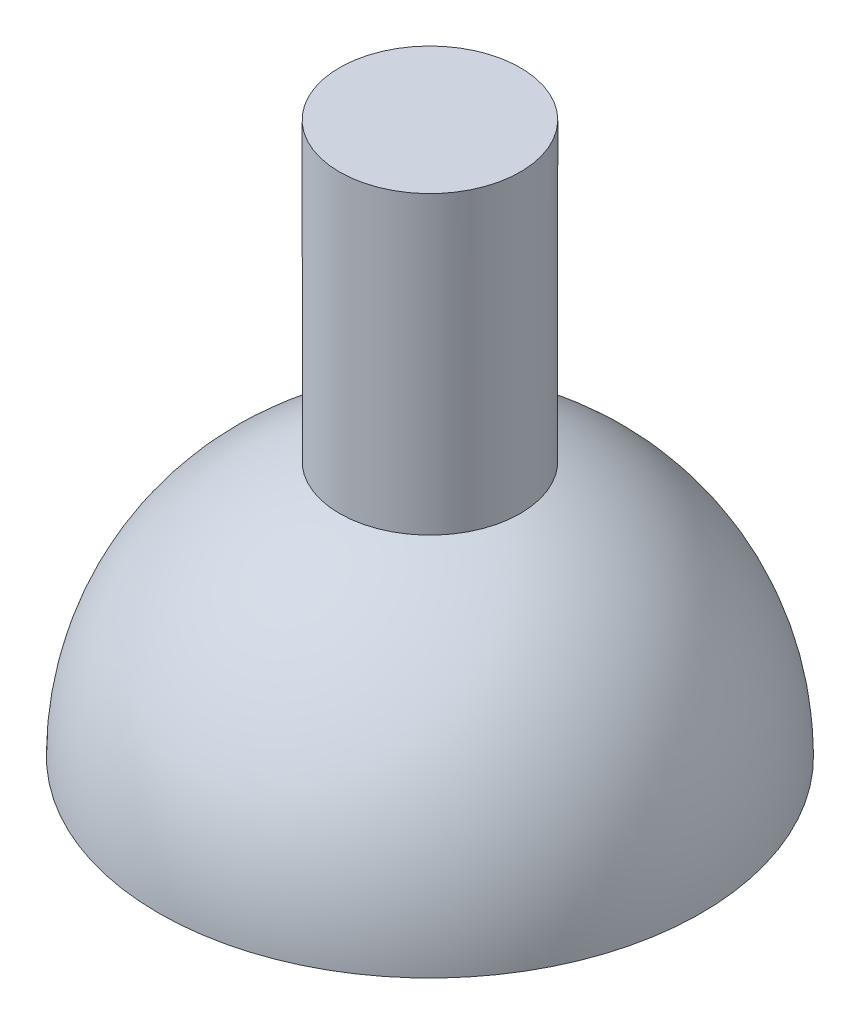
from build123d import *

# Parameters (mm, degrees)
BOSS_EXTRUDE1_DEPTH      = 31
BOSS_EXTRUDE1_DEPTH_BACK = 4
SKETCH7_R                = 10
SKETCH10_R               = 30
CUT_EXTRUDE1_DEPTH       = 47


# Read off the part's stored shape, not the designer's step: Shell1
with BuildPart() as part:
    # Sketch5 → Revolve3 (revolve)
    with BuildSketch(Plane(origin=(0, 0, 0), x_dir=(1, 0, 0), z_dir=(0, 1, 0))):
        with BuildLine():
            Line((0, -30), (0, 30))
            ThreePointArc((0, 30), (30, 0), (0, -30))
        make_face()
    revolve(axis=Axis((0, 0, 30), (0, 0, -1)))

    # Sketch7 → Boss-Extrude1 (add, two sides: drawn at the far end of the back side and taken through both)
    with BuildSketch(Plane(origin=(0, 30, 0), x_dir=(1, 0, 0), z_dir=(0, 1, 0)).offset(-BOSS_EXTRUDE1_DEPTH_BACK)):
        with Locations(Location((0, 0, 0), (0, 0, 270))):
            Circle(SKETCH7_R)
    extrude(amount=BOSS_EXTRUDE1_DEPTH + BOSS_EXTRUDE1_DEPTH_BACK)

    # Sketch10 → Cut-Extrude1 (cut)
    with BuildSketch(Plane(origin=(0, 0, 0), x_dir=(1, 0, 0), z_dir=(0, 1, 0))):
        Circle(SKETCH10_R)
    extrude(amount=-CUT_EXTRUDE1_DEPTH, mode=Mode.SUBTRACT)

    # Shell1 outline → Shell1 (revolve, cut)
    with BuildSketch(Plane.XY):
        with BuildLine():
            ThreePointArc((29, -2.9e-08), (23.473389189, 17.029386366), (8.999999972, 27.568097513))
            Line((8.999999972, 27.568097513), (9, 60))
            Line((9, 60), (0, 60))
            Line((0, 60), (0, -2.9e-08))
            Line((0, -2.9e-08), (29, -2.9e-08))
        make_face()
    revolve(axis=Axis((0, 0, 0), (0, 1, 0)), mode=Mode.SUBTRACT)


solid = part.part
